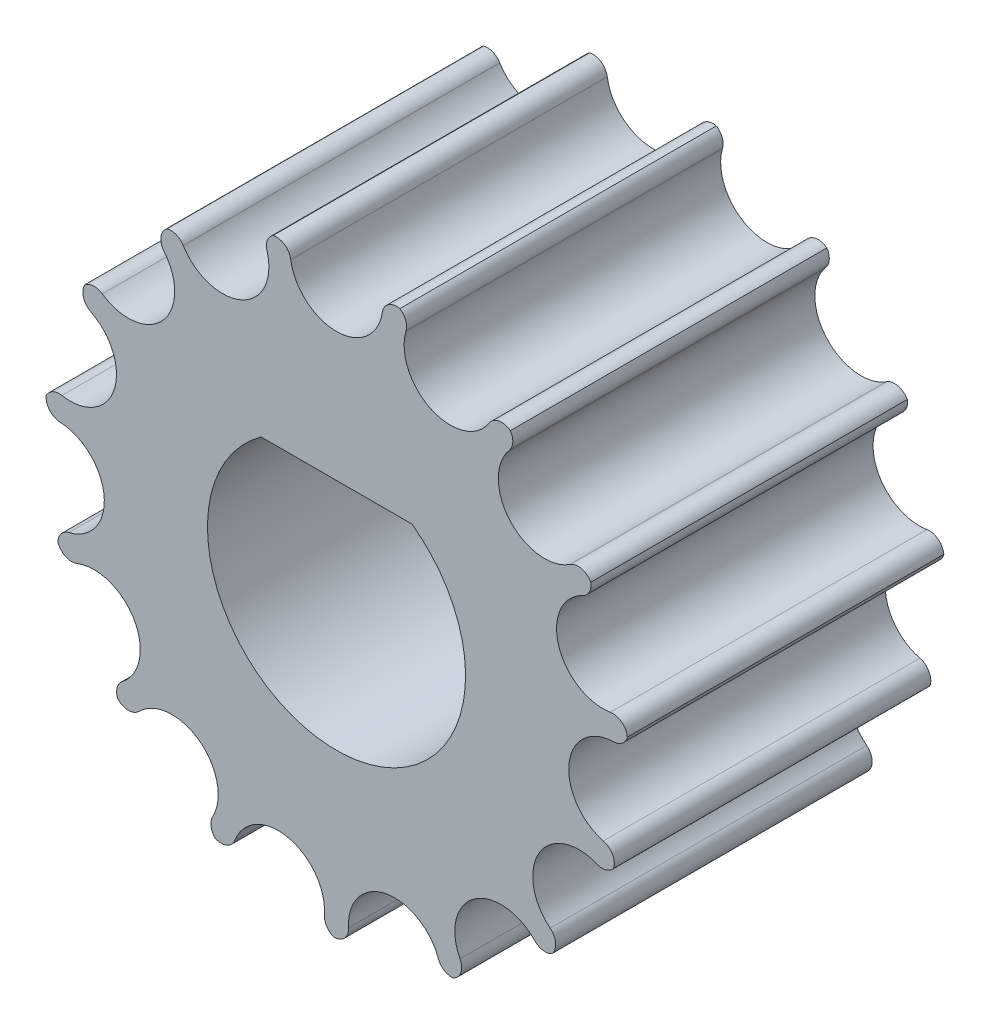
from build123d import *

# Parameters (mm, degrees)
SKIZZE1_R                            = 6
AUFSATZ_LINEAR_AUSTRAGEN1_DEPTH      = 3.25
SCHNITT_LINEAR_AUSTRAGEN1_DEPTH      = 10.086390923
VERRUNDUNG2_R                        = 0.3
KREISMUSTER1_START                   = -3.25
KREISMUSTER1_DEPTH                   = 6.5
SCHNITT_LINEAR_AUSTRAGEN2_DEPTH      = 10.068181427
SCHNITT_LINEAR_AUSTRAGEN2_DEPTH_BACK = 10.068181427


# Read off the part's stored shape, not the designer's step: Kreismuster1
with BuildPart() as part:
    # Skizze1 → Aufsatz-Linear austragen1 (new, symmetric)
    with BuildSketch(Plane.XY):
        with Locations(Location((0, 0, 0), (0, 0, 180))):
            Circle(SKIZZE1_R)
    extrude(amount=AUFSATZ_LINEAR_AUSTRAGEN1_DEPTH, both=True)

    # Skizze2 → Schnitt-Linear austragen1 (cut, symmetric)
    with BuildSketch(Plane.XY):
        with BuildLine():
            Line((0.95, 5.75), (0.95, 6))
            Line((0.95, 6), (-0.95, 6))
            Line((-0.95, 6), (-0.95, 5.75))
            ThreePointArc((-0.95, 5.75), (0, 4.8), (0.95, 5.75))
        make_face()
    extrude(amount=SCHNITT_LINEAR_AUSTRAGEN1_DEPTH, both=True, mode=Mode.SUBTRACT)

    # Verrundung2
    verrundung2_edges = [part.edges().sort_by_distance(p)[0] for p in [
        (0.95, 5.924314306, 0),
        (-0.95, 5.924314306, 0),
    ]]
    fillet(verrundung2_edges, radius=VERRUNDUNG2_R)

    # Kreismuster1 outline → Kreismuster1 (cut)
    with BuildSketch(Plane.XY.offset(KREISMUSTER1_START)):
        with BuildLine():
            ThreePointArc((1.301196241, 5.857208238), (1.4202728, 5.709694635), (1.427132072, 5.520241632))
            ThreePointArc((1.427132072, 5.520241632), (1.945632522, 4.388033855), (3.139589709, 4.741874783))
            ThreePointArc((3.139589709, 4.741874783), (3.337990982, 4.875510752), (3.571043132, 4.821581789))
            ThreePointArc((3.571043132, 4.821581789), (2.49054405, 5.458680274), (1.301196241, 5.857208238))
        make_face()
        with BuildLine():
            ThreePointArc((-1.301196241, 5.857208238), (-2.440419859, 5.481272746), (-3.482083764, 4.886214553))
            ThreePointArc((-3.482083764, 4.886214553), (-3.292782023, 4.875999815), (-3.147401255, 4.754328445))
            ThreePointArc((-3.147401255, 4.754328445), (-1.952335887, 4.385018197), (-1.427132072, 5.520241632))
            ThreePointArc((-1.427132072, 5.520241632), (-1.4202728, 5.709694635), (-1.301196241, 5.857208238))
        make_face()
        with BuildLine():
            ThreePointArc((-3.482083764, 4.886214553), (-4.421893009, 4.055473119), (-5.168444311, 3.047488049))
            ThreePointArc((-5.168444311, 3.047488049), (-4.991353857, 3.115152376), (-4.809053712, 3.063131734))
            ThreePointArc((-4.809053712, 3.063131734), (-3.572034677, 3.206383521), (-3.539604337, 4.451247144))
            ThreePointArc((-3.539604337, 4.451247144), (-3.60539033, 4.681233753), (-3.482083764, 4.886214553))
        make_face()
        with BuildLine():
            ThreePointArc((-5.168444311, 3.047488049), (-5.689109795, 1.906313128), (-5.961133882, 0.681823175))
            ThreePointArc((-5.961133882, 0.681823175), (-5.826875264, 0.815666791), (-5.639177093, 0.842291719))
            ThreePointArc((-5.639177093, 0.842291719), (-4.567369724, 1.476299708), (-5.044074785, 2.626729824))
            ThreePointArc((-5.044074785, 2.626729824), (-5.197717262, 2.810075472), (-5.168444311, 3.047488049))
        make_face()
        with BuildLine():
            ThreePointArc((-5.961133882, 0.681823175), (-5.972627813, -0.572465721), (-5.72308925, -1.801735119))
            ThreePointArc((-5.72308925, -1.801735119), (-5.654877001, -1.624854993), (-5.494235524, -1.524188187))
            ThreePointArc((-5.494235524, -1.524188187), (-4.772965052, -0.509049737), (-5.676378878, 0.348027053))
            ThreePointArc((-5.676378878, 0.348027053), (-5.891311659, 0.453029612), (-5.961133882, 0.681823175))
        make_face()
        with BuildLine():
            ThreePointArc((-5.72308925, -1.801735119), (-5.223424224, -2.952260046), (-4.495470494, -3.973757043))
            ThreePointArc((-4.495470494, -3.973757043), (-4.505099133, -3.784424586), (-4.39929072, -3.627122108))
            ThreePointArc((-4.39929072, -3.627122108), (-4.153271361, -2.406379857), (-5.327185496, -1.990852756))
            ThreePointArc((-5.327185496, -1.990852756), (-5.566244749, -1.982349183), (-5.72308925, -1.801735119))
        make_face()
        with BuildLine():
            ThreePointArc((-4.495470494, -3.973757043), (-3.571043132, -4.821581789), (-2.490544049, -5.458680274))
            ThreePointArc((-2.490544049, -5.458680274), (-2.576348697, -5.289632788), (-2.543668584, -5.102893665))
            ThreePointArc((-2.543668584, -5.102893665), (-2.815439322, -3.887625039), (-4.056873345, -3.985496038))
            ThreePointArc((-4.056873345, -3.985496038), (-4.278723555, -4.074961795), (-4.495470494, -3.973757043))
        make_face()
        with BuildLine():
            ThreePointArc((-2.490544049, -5.458680274), (-1.301196241, -5.857208238), (-0.054979913, -5.999748095))
            ThreePointArc((-0.054979913, -5.999748095), (-0.202124166, -5.880215427), (-0.248223041, -5.69632855))
            ThreePointArc((-0.248223041, -5.69632855), (-0.990792245, -4.696664534), (-2.085090937, -5.291010847))
            ThreePointArc((-2.085090937, -5.291010847), (-2.251372186, -5.462976493), (-2.490544049, -5.458680274))
        make_face()
        with BuildLine():
            ThreePointArc((-0.054979913, -5.999748095), (1.193639301, -5.880070171), (2.39009075, -5.503404965))
            ThreePointArc((2.39009075, -5.503404965), (2.20704947, -5.454055398), (2.090142521, -5.304816478))
            ThreePointArc((2.090142521, -5.304816478), (1.005171811, -4.693608063), (0.247222636, -5.681661814))
            ThreePointArc((0.247222636, -5.681661814), (0.165261886, -5.906392926), (-0.054979913, -5.999748095))
        make_face()
        with BuildLine():
            ThreePointArc((2.39009075, -5.503404965), (3.482083764, -4.886214553), (4.421893009, -4.055473119))
            ThreePointArc((4.421893009, -4.055473119), (4.234604202, -4.084839642), (4.067103452, -3.996053445))
            ThreePointArc((4.067103452, -3.996053445), (2.82733253, -3.878984118), (2.53678917, -5.089901837))
            ThreePointArc((2.53678917, -5.089901837), (2.553320677, -5.328540364), (2.39009075, -5.503404965))
        make_face()
        with BuildLine():
            ThreePointArc((4.421893009, -4.055473119), (5.168444311, -3.047488049), (5.689109795, -1.906313128))
            ThreePointArc((5.689109795, -1.906313128), (5.529957397, -2.009318003), (5.340825248, -1.996336468))
            ThreePointArc((5.340825248, -1.996336468), (4.160621768, -2.393648579), (4.38772181, -3.618051592))
            ThreePointArc((4.38772181, -3.618051592), (4.499887126, -3.829334765), (4.421893009, -4.055473119))
        make_face()
        with BuildLine():
            ThreePointArc((5.689109795, -1.906313128), (5.961133882, -0.681823176), (5.972627814, 0.572465721))
            ThreePointArc((5.972627814, 0.572465721), (5.86913072, 0.413632974), (5.691069839, 0.34856522))
            ThreePointArc((5.691069839, 0.34856522), (4.774501705, -0.494429456), (5.479977488, -1.520607358))
            ThreePointArc((5.479977488, -1.520607358), (5.668382211, -1.668002397), (5.689109795, -1.906313128))
        make_face()
        with BuildLine():
            ThreePointArc((5.972627814, 0.572465721), (5.72308925, 1.801735119), (5.223424223, 2.952260047))
            ThreePointArc((5.223424223, 2.952260047), (5.193478023, 2.765063051), (5.057276753, 2.633196816))
            ThreePointArc((5.057276753, 2.633196816), (4.562826922, 1.490281013), (5.624695274, 0.839763703))
            ThreePointArc((5.624695274, 0.839763703), (5.856762517, 0.78174274), (5.972627814, 0.572465721))
        make_face()
        with BuildLine():
            ThreePointArc((5.223424223, 2.952260047), (4.495470494, 3.973757044), (3.571043132, 4.821581789))
            ThreePointArc((3.571043132, 4.821581789), (3.619825794, 4.638388607), (3.549034572, 4.462524759))
            ThreePointArc((3.549034572, 4.462524759), (3.562197912, 3.217308355), (4.796852148, 3.05493199))
            ThreePointArc((4.796852148, 3.05493199), (5.032455375, 3.096317454), (5.223424223, 2.952260047))
        make_face()
    extrude(amount=KREISMUSTER1_DEPTH, mode=Mode.SUBTRACT)

    # Skizze3 → Schnitt-Linear austragen2 (cut, two sides: drawn at the far end of the back side and taken through both)
    with BuildSketch(Plane.XY.offset(-SCHNITT_LINEAR_AUSTRAGEN2_DEPTH_BACK)):
        with BuildLine():
            Line((1.549193338, 2.15), (-1.549193338, 2.15))
            ThreePointArc((-1.549193338, 2.15), (0, -2.65), (1.549193338, 2.15))
        make_face()
    extrude(amount=SCHNITT_LINEAR_AUSTRAGEN2_DEPTH + SCHNITT_LINEAR_AUSTRAGEN2_DEPTH_BACK, mode=Mode.SUBTRACT)


solid = part.part
